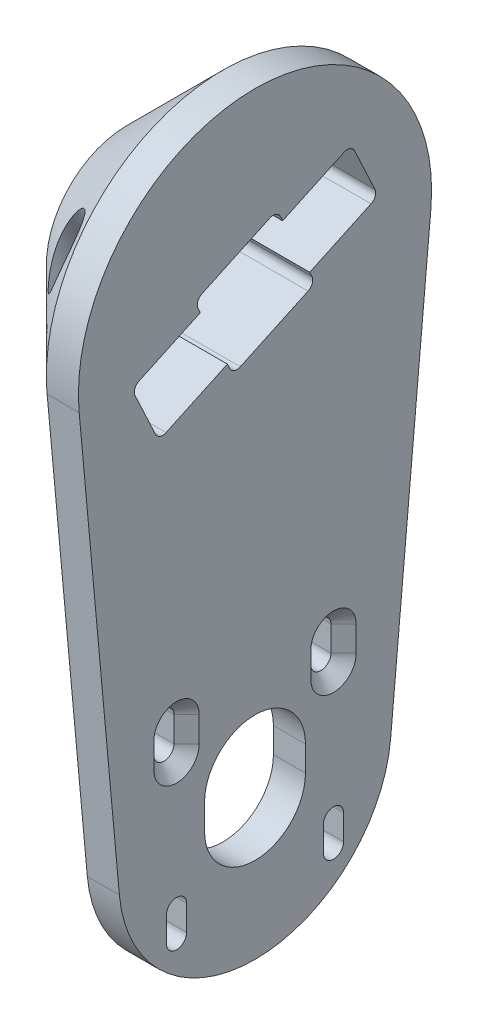
from build123d import *

# Parameters (mm, degrees)
BOSS_EXTRUDE1_DEPTH = 6.35
SKETCH20_R          = 35
BOSS_EXTRUDE5_DEPTH = 19.05
CUT_EXTRUDE14_DEPTH = 123.39448517
CHAMFER1_SIZE       = 19.05
SKETCH22_R          = 3.175
CUT_EXTRUDE15_DEPTH = 129.555411344
SKETCH24_R          = 5
CUT_EXTRUDE16_DEPTH = 134.419011414
SKETCH25_R          = 2.38125
CUT_EXTRUDE17_DEPTH = 10
CUT_EXTRUDE18_DEPTH = 10
CHAMFER3_SIZE       = 2.5
FILLET1_R           = 1.5875


with BuildPart() as part:
    # Sketch1 → Boss-Extrude1 (new body)
    with BuildSketch(Plane(origin=(0, 0, 0), x_dir=(0, 0, -1), z_dir=(1, 0, 0))):
        with BuildLine():
            Line((-34.853407294, -3.2), (-26.886914198, -89.968571429))
            ThreePointArc((-26.886914198, -89.968571429), (0, -114.5), (26.886914198, -89.968571429))
            Line((26.886914198, -89.968571429), (34.853407294, -3.2))
            ThreePointArc((34.853407294, -3.2), (0, 35), (-34.853407294, -3.2))
        make_face()
        Polygon((4.353205728, 11.960334439), (-11.960334439, 4.353205728), (-4.353205728, -11.960334439), (11.960334439, -4.353205728), align=None, mode=Mode.SUBTRACT)
    extrude(amount=BOSS_EXTRUDE1_DEPTH)

    # Sketch20 → Boss-Extrude5 (add)
    with BuildSketch(Plane(origin=(6.35, 0, 0), x_dir=(0, 0, -1), z_dir=(1, 0, 0))):
        with Locations(Location((0, 0, 0), (0, 0, 185.245797084))):
            Circle(SKETCH20_R)
    extrude(amount=BOSS_EXTRUDE5_DEPTH)

    # Sketch21 → Cut-Extrude14 (cut, through all)
    with BuildSketch(Plane.ZY):
        Polygon((-19.067760927, 15.897892729), (-24.435012851, 4.387783834), (-10.840396045, -1.951490092), (-5.473144121, 9.558618803), align=None)
        Polygon((-11.960334439, -4.353205728), (-4.353205728, 11.960334439), (11.960334439, 4.353205728), (4.353205728, -11.960334439), align=None)
        Polygon((10.840396045, 1.951490092), (5.473144121, -9.558618803), (19.067760927, -15.897892729), (24.435012851, -4.387783834), align=None)
    extrude(amount=-CUT_EXTRUDE14_DEPTH, mode=Mode.SUBTRACT)

    # Chamfer1
    # the kernel refuses this chamfer: 19.05 mm, written as the material it takes off along each edge
    with BuildSketch(Plane(origin=(25.4, 0, 0), x_dir=(0, -0.09142857142327497, 0.9958116369713196), z_dir=(0, 0.9958116369713196, 0.09142857142327497))) as chamfer1_piece_1:
        Polygon((35 - CHAMFER1_SIZE, 0), (35, -CHAMFER1_SIZE), (35, 0), align=None)
    revolve(axis=Axis((25.4, 0, 0), (1, 0, 0)), mode=Mode.SUBTRACT)

    # Sketch22 → Cut-Extrude15 (cut, through all)
    with BuildSketch(Plane(origin=(0, 5.755054448, 2.683625962), x_dir=(-1, 0, 0), z_dir=(0, -0.9063077870366495, -0.4226182617407006))):
        with Locations(Location((-13.4, -16.5, 0), (0, 0, 90))):
            Circle(SKETCH22_R)
    cut_extrude15 = extrude(amount=-CUT_EXTRUDE15_DEPTH, mode=Mode.SUBTRACT)

    # Sketch24 → Cut-Extrude16 (cut, through all)
    with BuildSketch(Plane(origin=(0, 10.286593383, 4.796717271), x_dir=(-1, 0, 0), z_dir=(0, -0.9063077870366495, -0.4226182617407006))):
        with Locations(Location((-13.4, -16.5, 0), (0, 0, 90))):
            Circle(SKETCH24_R)
    cut_extrude16 = extrude(amount=-CUT_EXTRUDE16_DEPTH, mode=Mode.SUBTRACT)

    # Sketch25 → Cut-Extrude17 (cut)
    with BuildSketch(Plane(origin=(0, -5.755054448, -2.683625962), x_dir=(1, 0, 0), z_dir=(0, 0.9063077870366495, 0.4226182617407006))):
        with Locations(Location((13.4, -16.5, 0), (0, 0, 270))):
            Circle(SKETCH25_R)
    cut_extrude17 = extrude(amount=-CUT_EXTRUDE17_DEPTH, mode=Mode.SUBTRACT)

    # Mirror1: Cut-Extrude15, Cut-Extrude16, Cut-Extrude17 across plane
    add(cut_extrude15.mirror(Plane(origin=(0, 0, 0), x_dir=(1, 0, 0), z_dir=(0, 0.422618261740701, -0.9063077870366492))), mode=Mode.SUBTRACT)
    add(cut_extrude16.mirror(Plane(origin=(0, 0, 0), x_dir=(1, 0, 0), z_dir=(0, 0.422618261740701, -0.9063077870366492))), mode=Mode.SUBTRACT)
    add(cut_extrude17.mirror(Plane(origin=(0, 0, 0), x_dir=(1, 0, 0), z_dir=(0, 0.422618261740701, -0.9063077870366492))), mode=Mode.SUBTRACT)

    # Sketch19 → Cut-Extrude18 (cut)
    with BuildSketch(Plane(origin=(6.35, 0, 0), x_dir=(0, 0, -1), z_dir=(1, 0, 0))):
        with BuildLine():
            Line((13.556349186, -66.943650814), (13.556349186, -71.943650814))
            ThreePointArc((13.556349186, -71.943650814), (15.556349186, -73.943650814), (17.556349186, -71.943650814))
            Line((17.556349186, -71.943650814), (17.556349186, -66.943650814))
            ThreePointArc((17.556349186, -66.943650814), (15.556349186, -64.943650814), (13.556349186, -66.943650814))
        make_face()
        with BuildLine():
            Line((-10, -82.5), (-10, -87.5))
            ThreePointArc((-10, -87.5), (0, -97.5), (10, -87.5))
            Line((10, -87.5), (10, -82.5))
            ThreePointArc((10, -82.5), (0, -72.5), (-10, -82.5))
        make_face()
        with BuildLine():
            Line((17.556349186, -103.056349186), (17.556349186, -98.056349186))
            ThreePointArc((17.556349186, -98.056349186), (15.556349186, -96.056349186), (13.556349186, -98.056349186))
            Line((13.556349186, -98.056349186), (13.556349186, -103.056349186))
            ThreePointArc((13.556349186, -103.056349186), (15.556349186, -105.056349186), (17.556349186, -103.056349186))
        make_face()
        with BuildLine():
            Line((-17.556349186, -66.943650814), (-17.556349186, -71.943650814))
            ThreePointArc((-17.556349186, -71.943650814), (-15.556349186, -73.943650814), (-13.556349186, -71.943650814))
            Line((-13.556349186, -71.943650814), (-13.556349186, -66.943650814))
            ThreePointArc((-13.556349186, -66.943650814), (-15.556349186, -64.943650814), (-17.556349186, -66.943650814))
        make_face()
        with BuildLine():
            Line((-13.556349186, -103.056349186), (-13.556349186, -98.056349186))
            ThreePointArc((-13.556349186, -98.056349186), (-15.556349186, -96.056349186), (-17.556349186, -98.056349186))
            Line((-17.556349186, -98.056349186), (-17.556349186, -103.056349186))
            ThreePointArc((-17.556349186, -103.056349186), (-15.556349186, -105.056349186), (-13.556349186, -103.056349186))
        make_face()
    extrude(amount=-CUT_EXTRUDE18_DEPTH, mode=Mode.SUBTRACT)


with BuildPart() as body_2:
    # Mirror2: mirrored copy
    add(part.part.mirror(Plane(origin=(0, 0, 0), x_dir=(0, 0, 1), z_dir=(1, 0, 0))))

    # Chamfer3
    chamfer3_edges = [body_2.edges().sort_by_distance(p)[0] for p in [
        (0, -69.443650814, 13.556349186),
        (0, -64.943650814, 15.556349186),
        (0, -69.443650814, 17.556349186),
        (0, -73.943650814, 15.556349186),
        (0, -69.443650814, -17.556349186),
        (0, -64.943650814, -15.556349186),
        (0, -69.443650814, -13.556349186),
        (0, -73.943650814, -15.556349186),
    ]]
    chamfer(chamfer3_edges, length=CHAMFER3_SIZE)

    # Fillet1
    fillet1_edges = [body_2.edges().sort_by_distance(p)[0] for p in [
        (-8.262078305, 4.387783834, -24.435012851),
        (-8.262078305, 15.897892729, -19.067760927),
        (-8.262078305, -4.387783834, 24.435012851),
        (-8.262078305, -15.897892729, 19.067760927),
        (-12.7, 11.960334439, -4.353205728),
        (-12.7, 4.353205728, 11.960334439),
        (-12.7, -11.960334439, 4.353205728),
        (-12.7, -4.353205728, -11.960334439),
    ]]
    fillet(fillet1_edges, radius=FILLET1_R)


solid = body_2.part
